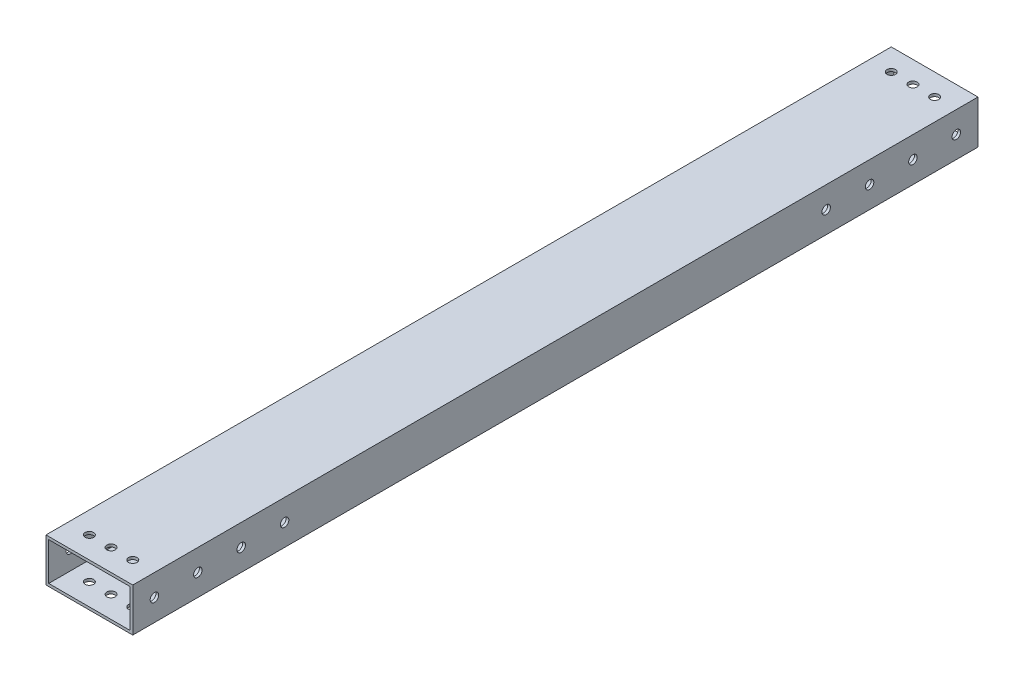
from build123d import *

# Parameters (mm, degrees)
SKETCH1_W           = 50.8
SKETCH1_H           = 25.4
SKETCH1_W_2         = 47.625
SKETCH1_H_2         = 22.225
BOSS_EXTRUDE1_DEPTH = 247.474994
SKETCH2_R           = 2.4892
CUT_EXTRUDE1_DEPTH  = 251.06837596
SKETCH3_R           = 2.4892
CUT_EXTRUDE2_DEPTH  = 253.954151291


with BuildPart() as part:
    # Sketch1 → Boss-Extrude1 (new, symmetric)
    with BuildSketch(Plane.XY):
        Rectangle(SKETCH1_W, SKETCH1_H)
        Rectangle(SKETCH1_W_2, SKETCH1_H_2, mode=Mode.SUBTRACT)
    extrude(amount=BOSS_EXTRUDE1_DEPTH, both=True)

    # Sketch2 → Cut-Extrude1 (cut, through all)
    with BuildSketch(Plane(origin=(0, 12.7, 0), x_dir=(1, 0, 0), z_dir=(0, 1, 0))):
        with Locations((-12.7, 234.774994)):
            Circle(SKETCH2_R)
        with Locations((0, 234.774994)):
            Circle(SKETCH2_R)
        with Locations((12.7, 234.774994)):
            Circle(SKETCH2_R)
        with Locations((12.7, -234.774994)):
            Circle(SKETCH2_R)
        with Locations((0, -234.774994)):
            Circle(SKETCH2_R)
        with Locations((-12.7, -234.774994)):
            Circle(SKETCH2_R)
    extrude(amount=-CUT_EXTRUDE1_DEPTH, mode=Mode.SUBTRACT)

    # Sketch3 → Cut-Extrude2 (cut, through all)
    with BuildSketch(Plane(origin=(25.4, 0, 0), x_dir=(0, 0, -1), z_dir=(1, 0, 0))):
        with Locations((234.774994, 0)):
            Circle(SKETCH3_R)
        with Locations((-234.774994, 0)):
            Circle(SKETCH3_R)
        with Locations((209.374994, 0)):
            Circle(SKETCH3_R)
        with Locations((183.974994, 0)):
            Circle(SKETCH3_R)
        with Locations((158.574994, 0)):
            Circle(SKETCH3_R)
        with Locations((-158.574994, 0)):
            Circle(SKETCH3_R)
        with Locations((-183.974994, 0)):
            Circle(SKETCH3_R)
        with Locations((-209.374994, 0)):
            Circle(SKETCH3_R)
    extrude(amount=-CUT_EXTRUDE2_DEPTH, mode=Mode.SUBTRACT)


solid = part.part
